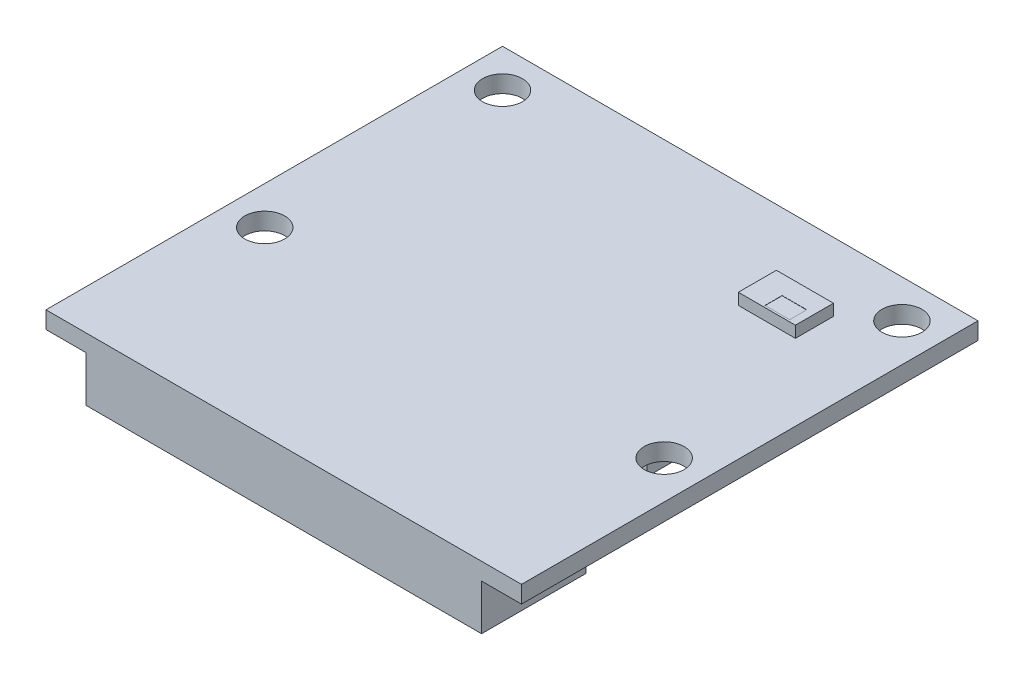
from build123d import *

# Parameters (mm, degrees)
SKIZZE1_W                                 = 25
SKIZZE1_H                                 = 24
PCB_DEPTH                                 = 0.9
SKIZZE2_R                                 = 1.05
MOUNTING_HOLES_DEPTH                      = 20.165333287
SKIZZE3_W                                 = 20.8
SKIZZE3_H                                 = 5.5
CONNECTOR_CLOSED_DEPTH                    = 2.4
SKIZZE4_W                                 = 17.7
SKIZZE4_H                                 = 11.6
COMPONENTS_WORST_CASE_BOUNDARY_BOX_DEPTH  = 1.3
SKIZZE7_W                                 = 3
SKIZZE7_H                                 = 2
COMPONENTS_WORST_CASE_BOUNDARY_BOX2_DEPTH = 0.6
SKIZZE8_W                                 = 1.3
SKIZZE8_H                                 = 0.9
STATUS_LED_DEPTH                          = 0.01


with BuildPart() as part:
    # Skizze1 → PCB (new body)
    with BuildSketch(Plane(origin=(0, 0, 0), x_dir=(1, 0, 0), z_dir=(0, 1, 0))):
        with Locations((0, 2.5)):
            Rectangle(SKIZZE1_W, SKIZZE1_H)
    extrude(amount=-PCB_DEPTH)

    # Skizze2 → Mounting_Holes (cut, through all)
    with BuildSketch(Plane(origin=(0, 0, 0), x_dir=(1, 0, 0), z_dir=(0, 1, 0))):
        with Locations((10.5, 12.5)):
            Circle(SKIZZE2_R)
        with Locations((10.5, 0)):
            Circle(SKIZZE2_R)
        with Locations((-10.5, 0)):
            Circle(SKIZZE2_R)
        with Locations((-10.5, 12.5)):
            Circle(SKIZZE2_R)
    extrude(amount=-MOUNTING_HOLES_DEPTH, mode=Mode.SUBTRACT)

    # Skizze3 → Connector_closed (add)
    with BuildSketch(Plane.XZ.offset(0.9)):
        with Locations((0, 6.75)):
            Rectangle(SKIZZE3_W, SKIZZE3_H)
    extrude(amount=CONNECTOR_CLOSED_DEPTH)

    # Skizze4 → Components_worst-case_Boundary-Box (add)
    with BuildSketch(Plane.XZ.offset(0.9)):
        with Locations((-0.15, -6.7)):
            Rectangle(SKIZZE4_W, SKIZZE4_H)
    extrude(amount=COMPONENTS_WORST_CASE_BOUNDARY_BOX_DEPTH)

    # Skizze7 → Components_worst-case_Boundary-Box2 (add)
    with BuildSketch(Plane(origin=(0, 0, 0), x_dir=(1, 0, 0), z_dir=(0, 1, 0))):
        with Locations((7, 9.9)):
            Rectangle(SKIZZE7_W, SKIZZE7_H)
    extrude(amount=COMPONENTS_WORST_CASE_BOUNDARY_BOX2_DEPTH)

    # Skizze8 → Status_LED (cut)
    with BuildSketch(Plane(origin=(0, 0.6, 0), x_dir=(1, 0, 0), z_dir=(0, 1, 0))):
        with Locations((7.45, 9.45)):
            Rectangle(SKIZZE8_W, SKIZZE8_H)
    extrude(amount=-STATUS_LED_DEPTH, mode=Mode.SUBTRACT)


solid = part.part
